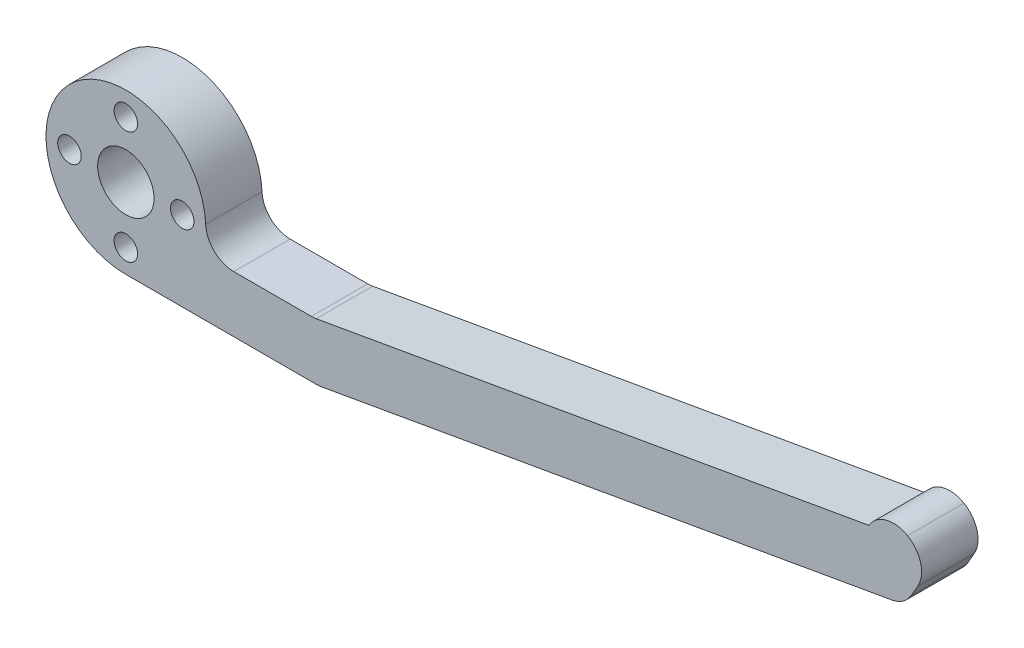
from build123d import *

# Parameters (mm, degrees)
ESQUISSE1_R                  = 8.5
BOSS_EXTRU_1_DEPTH           = 6
BOSS_EXTRU_2_DEPTH           = 6
BOSS_EXTRU_3_DEPTH           = 6
BOSS_EXTRU_4_DEPTH           = 6
ENL_V_MAT_EXTRU_1_DEPTH      = 87.634907569
ENL_V_MAT_EXTRU_1_DEPTH_BACK = 87.634907569
ESQUISSE4_R                  = 3
ESQUISSE4_R_2                = 1.25
CONG_1_R                     = 3


with BuildPart() as part:
    # Esquisse1 → Boss.-Extru.1 (new body)
    with BuildSketch(Plane.XY):
        Circle(ESQUISSE1_R)
    extrude(amount=BOSS_EXTRU_1_DEPTH)

    # Esquisse2 → Boss.-Extru.2 (add)
    with BuildSketch(Plane.XY.offset(6)):
        Polygon((0, -8.5), (20, -8.5), (20, -2.5), (8.124038405, -2.5), align=None)
    extrude(amount=-BOSS_EXTRU_2_DEPTH)

    # Esquisse3 → Boss.-Extru.3 (add)
    with BuildSketch(Plane.XY.offset(6)):
        Polygon((20, -2.5), (79.088465181, 7.91889066), (80.130354247, 2.010044142), (20.524931981, -8.5), (20, -8.5), align=None)
    extrude(amount=-BOSS_EXTRU_3_DEPTH)

    # Esquisse5 → Boss.-Extru.4 (add)
    with BuildSketch(Plane.XY.offset(6)):
        Polygon((80.130354247, 2.010044142), (82.885694629, 2.495884992), (85.784617603, 7.516966871), (80.588465181, 10.516966871), (79.088465181, 7.91889066), align=None)
    extrude(amount=-BOSS_EXTRU_4_DEPTH)

    # Esquisse4 → Enlèv. mat.-Extru.1 (cut, two sides: drawn at the far end of the back side and taken through both)
    with BuildSketch(Plane.XY.offset(6).offset(-ENL_V_MAT_EXTRU_1_DEPTH_BACK)):
        Circle(ESQUISSE4_R)
        with Locations((-6, 0)):
            Circle(ESQUISSE4_R_2)
        with Locations((0, 6)):
            Circle(ESQUISSE4_R_2)
        with Locations((6, 0)):
            Circle(ESQUISSE4_R_2)
        with Locations((0, -6)):
            Circle(ESQUISSE4_R_2)
    extrude(amount=ENL_V_MAT_EXTRU_1_DEPTH + ENL_V_MAT_EXTRU_1_DEPTH_BACK, mode=Mode.SUBTRACT)

    # Congé1
    cong_1_edges = [part.edges().sort_by_distance(p)[0] for p in [
        (20.524931981, -8.5, 3),
        (82.885694629, 2.495884992, 3),
        (85.784617603, 7.516966871, 3),
        (80.588465181, 10.516966871, 3),
        (20, -2.5, 3),
        (8.124038405, -2.5, 3),
    ]]
    fillet(cong_1_edges, radius=CONG_1_R - 0.0001)  # a hair under: the kernel refuses the full size


solid = part.part
